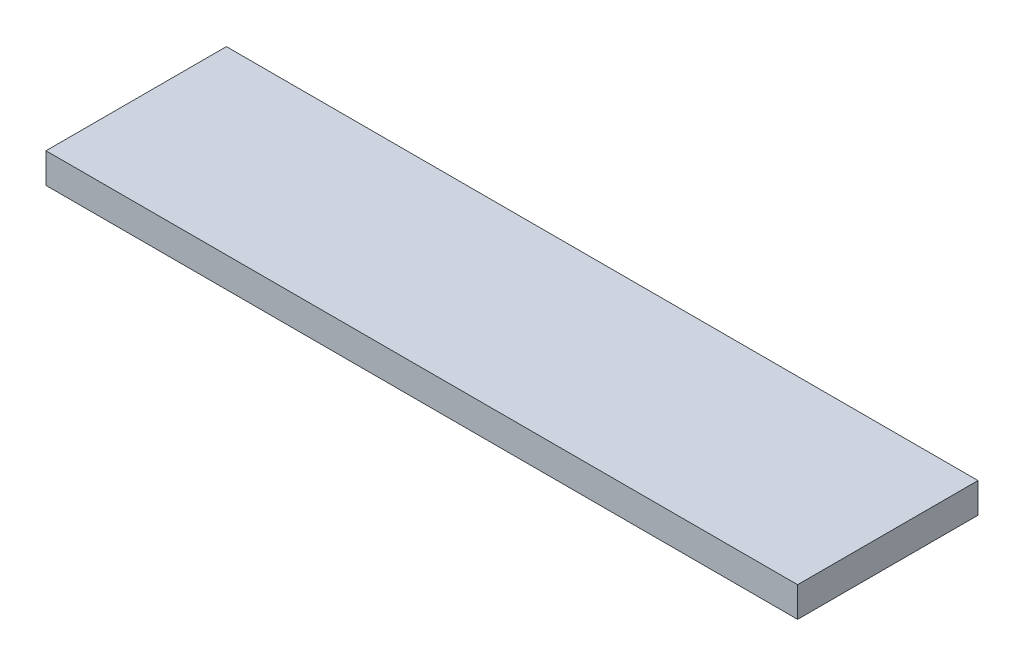
from build123d import *

# Parameters (mm, degrees)
SKETCH1_W           = 125
SKETCH1_H           = 30
BOSS_EXTRUDE1_DEPTH = 5


with BuildPart() as part:
    # Sketch1 → Boss-Extrude1 (new body)
    with BuildSketch(Plane(origin=(0, 0, 0), x_dir=(1, 0, 0), z_dir=(0, 1, 0))):
        Rectangle(SKETCH1_W, SKETCH1_H)
    extrude(amount=BOSS_EXTRUDE1_DEPTH)


solid = part.part
